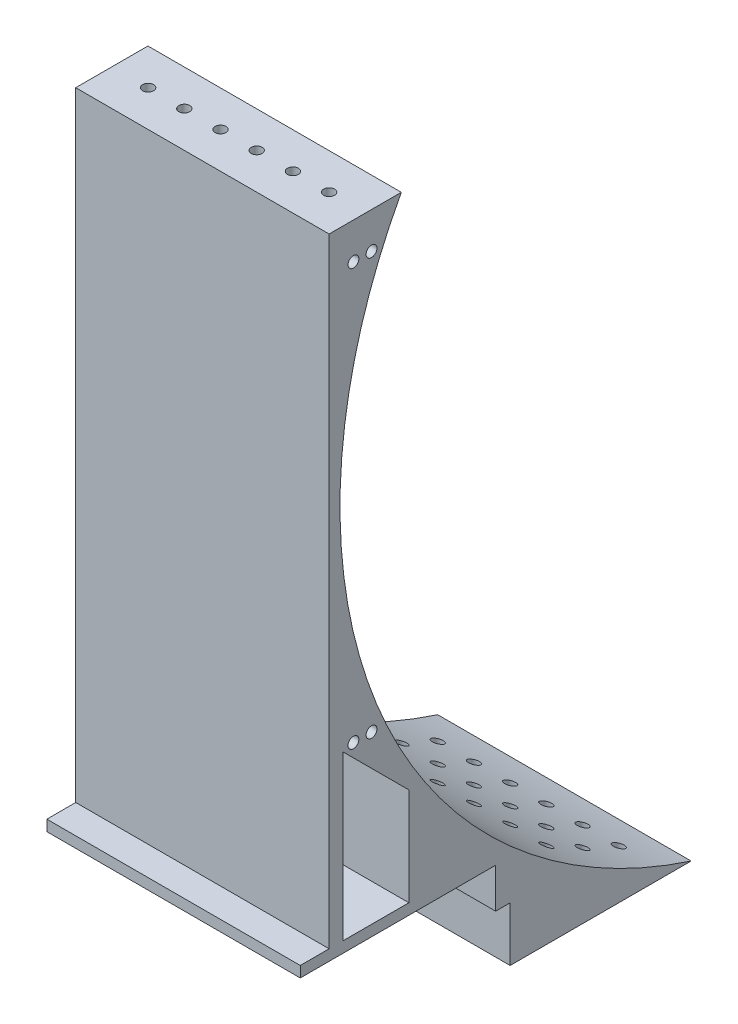
from build123d import *

# Parameters (mm, degrees)
BOSS_EXTRUDE1_DEPTH = 70
CUT_EXTRUDE2_DEPTH  = 235.307490277
SKETCH6_W           = 70
SKETCH6_H           = 3
BOSS_EXTRUDE2_DEPTH = 30
SKETCH7_R           = 1.5
CUT_EXTRUDE3_DEPTH  = 17
SKETCH8_R           = 1.5
CUT_EXTRUDE4_DEPTH  = 15
SKETCH9_R           = 1.5
CUT_EXTRUDE5_DEPTH  = 20
SKETCH10_R          = 1.5
CUT_EXTRUDE6_DEPTH  = 235.307490435


with BuildPart() as part:
    # Sketch1 → Boss-Extrude1 (new body)
    with BuildSketch(Plane(origin=(0, 0, 0), x_dir=(0, 0, -1), z_dir=(1, 0, 0))):
        with BuildLine():
            Line((0, 200), (0, 0))
            Line((0, 0), (100, 0))
            ThreePointArc((100, 0), (13.025244547, 81.208240961), (19.946550109, 200))
            Line((19.946550109, 200), (0, 200))
        make_face()
    extrude(amount=BOSS_EXTRUDE1_DEPTH)

    # Sketch5 → Cut-Extrude2 (cut, through all)
    with BuildSketch(Plane(origin=(70, 0, 0), x_dir=(0, 0, -1), z_dir=(1, 0, 0))):
        Polygon((22.027296405, 26), (22.027296405, 56), (3.858869779, 74.168426626), (3.858869779, 26), (0, 26), (0, 0), (50, 0), (50, 15), (46, 15), (46, 26), align=None)
    extrude(amount=-CUT_EXTRUDE2_DEPTH, mode=Mode.SUBTRACT)

    # Sketch6 → Boss-Extrude2 (add)
    with BuildSketch(Plane.XY.offset(-22.027296405)):
        with Locations((35, 27.5)):
            Rectangle(SKETCH6_W, SKETCH6_H)
    extrude(amount=BOSS_EXTRUDE2_DEPTH)

    # Sketch7 → Cut-Extrude3 (cut)
    with BuildSketch(Plane(origin=(0, 200, 0), x_dir=(1, 0, 0), z_dir=(0, 1, 0))):
        with Locations((10, 10)):
            Circle(SKETCH7_R)
        with Locations((20, 10)):
            Circle(SKETCH7_R)
        with Locations((30, 10)):
            Circle(SKETCH7_R)
        with Locations((40, 10)):
            Circle(SKETCH7_R)
        with Locations((50, 10)):
            Circle(SKETCH7_R)
        with Locations((60, 10)):
            Circle(SKETCH7_R)
    extrude(amount=-CUT_EXTRUDE3_DEPTH, mode=Mode.SUBTRACT)

    # Sketch8 → Cut-Extrude4 (cut)
    with BuildSketch(Plane.XZ):
        with Locations((10, -90)):
            Circle(SKETCH8_R)
        with Locations((20, -90)):
            Circle(SKETCH8_R)
        with Locations((30, -90)):
            Circle(SKETCH8_R)
        with Locations((40, -90)):
            Circle(SKETCH8_R)
        with Locations((50, -90)):
            Circle(SKETCH8_R)
        with Locations((60, -90)):
            Circle(SKETCH8_R)
        with Locations((20, -80)):
            Circle(SKETCH8_R)
        with Locations((30, -80)):
            Circle(SKETCH8_R)
        with Locations((40, -80)):
            Circle(SKETCH8_R)
        with Locations((50, -80)):
            Circle(SKETCH8_R)
        with Locations((60, -80)):
            Circle(SKETCH8_R)
        with Locations((20, -70)):
            Circle(SKETCH8_R)
        with Locations((30, -70)):
            Circle(SKETCH8_R)
        with Locations((40, -70)):
            Circle(SKETCH8_R)
        with Locations((50, -70)):
            Circle(SKETCH8_R)
        with Locations((60, -70)):
            Circle(SKETCH8_R)
        with Locations((20, -60)):
            Circle(SKETCH8_R)
        with Locations((30, -60)):
            Circle(SKETCH8_R)
        with Locations((40, -60)):
            Circle(SKETCH8_R)
        with Locations((50, -60)):
            Circle(SKETCH8_R)
        with Locations((60, -60)):
            Circle(SKETCH8_R)
        with Locations((10, -80)):
            Circle(SKETCH8_R)
        with Locations((10, -70)):
            Circle(SKETCH8_R)
        with Locations((10, -60)):
            Circle(SKETCH8_R)
    extrude(amount=-CUT_EXTRUDE4_DEPTH, mode=Mode.SUBTRACT)

    # Sketch9 → Cut-Extrude5 (cut)
    with BuildSketch(Plane.XZ.offset(-26)):
        with Locations((20, -6)):
            Circle(SKETCH9_R)
        with Locations((20, -31)):
            Circle(SKETCH9_R)
        with Locations((50, -31)):
            Circle(SKETCH9_R)
        with Locations((50, -6)):
            Circle(SKETCH9_R)
    extrude(amount=-CUT_EXTRUDE5_DEPTH, mode=Mode.SUBTRACT)

    # Sketch10 → Cut-Extrude6 (cut, through all)
    with BuildSketch(Plane(origin=(70, 0, 0), x_dir=(0, 0, -1), z_dir=(1, 0, 0))):
        with Locations((6.71, 75)):
            Circle(SKETCH10_R)
        with Locations((11.71, 75)):
            Circle(SKETCH10_R)
        with Locations((6.71, 190)):
            Circle(SKETCH10_R)
        with Locations((11.71, 190)):
            Circle(SKETCH10_R)
    extrude(amount=-CUT_EXTRUDE6_DEPTH, mode=Mode.SUBTRACT)


solid = part.part
